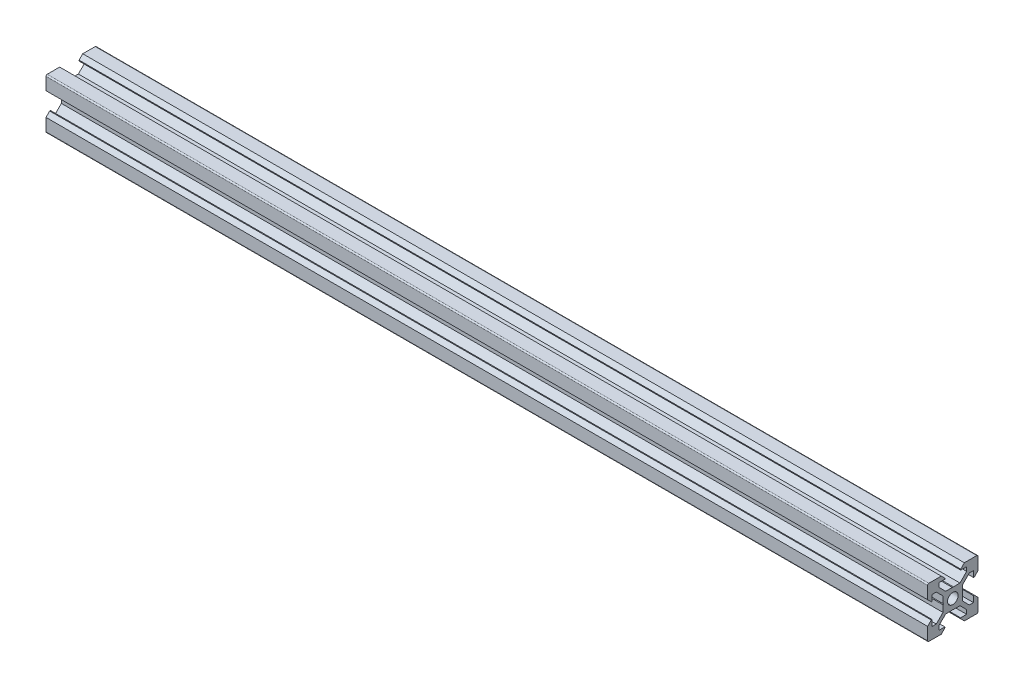
from build123d import *

# Parameters (mm, degrees)
PROFILE_SKETCH_R      = 2.1
PROFILE_EXTRUDE_DEPTH = 350


with BuildPart() as part:
    # Profile Sketch → Profile Extrude (new body)
    with BuildSketch(Plane(origin=(0, 0, 0), x_dir=(0, 0, -1), z_dir=(1, 0, 0))):
        with BuildLine():
            ThreePointArc((0, 9.5), (-0.146446609, 9.853553391), (-0.5, 10))
            Line((-0.5, 10), (-5.42, 10))
            Line((-5.42, 10), (-6.875, 8.545))
            Line((-6.875, 8.545), (-6.875, 8.2))
            Line((-6.875, 8.2), (-4.5, 8.2))
            Line((-4.5, 8.2), (-4.5, 6.56))
            Line((-4.5, 6.56), (-7.16, 3.9))
            Line((-7.16, 3.9), (-9.79, 3.9))
            Line((-9.79, 3.9), (-10, 3.69))
            Line((-10, 3.69), (-10.21, 3.9))
            Line((-10.21, 3.9), (-12.84, 3.9))
            Line((-12.84, 3.9), (-15.5, 6.56))
            Line((-15.5, 6.56), (-15.5, 8.2))
            Line((-15.5, 8.2), (-13.125, 8.2))
            Line((-13.125, 8.2), (-13.125, 8.545))
            Line((-13.125, 8.545), (-14.58, 10))
            Line((-14.58, 10), (-19.5, 10))
            ThreePointArc((-19.5, 10), (-19.853553391, 9.853553391), (-20, 9.5))
            Line((-20, 9.5), (-20, 4.58))
            Line((-20, 4.58), (-18.545, 3.125))
            Line((-18.545, 3.125), (-18.2, 3.125))
            Line((-18.2, 3.125), (-18.2, 5.5))
            Line((-18.2, 5.5), (-16.56, 5.5))
            Line((-16.56, 5.5), (-13.9, 2.838679656))
            Line((-13.9, 2.838679656), (-13.9, 0.21))
            Line((-13.9, 0.21), (-13.69, 0))
            Line((-13.69, 0), (-13.9, -0.21))
            Line((-13.9, -0.21), (-13.9, -2.838679656))
            Line((-13.9, -2.838679656), (-16.56, -5.5))
            Line((-16.56, -5.5), (-18.2, -5.5))
            Line((-18.2, -5.5), (-18.2, -3.125))
            Line((-18.2, -3.125), (-18.545, -3.125))
            Line((-18.545, -3.125), (-20, -4.58))
            Line((-20, -4.58), (-20, -9.5))
            ThreePointArc((-20, -9.5), (-19.853553391, -9.853553391), (-19.5, -10))
            Line((-19.5, -10), (-14.58, -10))
            Line((-14.58, -10), (-13.125, -8.545))
            Line((-13.125, -8.545), (-13.125, -8.2))
            Line((-13.125, -8.2), (-15.5, -8.2))
            Line((-15.5, -8.2), (-15.5, -6.56))
            Line((-15.5, -6.56), (-12.84, -3.9))
            Line((-12.84, -3.9), (-10.21, -3.9))
            Line((-10.21, -3.9), (-10, -3.69))
            Line((-10, -3.69), (-9.79, -3.9))
            Line((-9.79, -3.9), (-7.16, -3.9))
            Line((-7.16, -3.9), (-4.5, -6.56))
            Line((-4.5, -6.56), (-4.5, -8.2))
            Line((-4.5, -8.2), (-6.875, -8.2))
            Line((-6.875, -8.2), (-6.875, -8.545))
            Line((-6.875, -8.545), (-5.42, -10))
            Line((-5.42, -10), (-0.5, -10))
            ThreePointArc((-0.5, -10), (-0.146446609, -9.853553391), (0, -9.5))
            Line((0, -9.5), (0, -4.58))
            Line((0, -4.58), (-1.455, -3.125))
            Line((-1.455, -3.125), (-1.8, -3.125))
            Line((-1.8, -3.125), (-1.8, -5.5))
            Line((-1.8, -5.5), (-3.44, -5.5))
            Line((-3.44, -5.5), (-6.1, -2.838679656))
            Line((-6.1, -2.838679656), (-6.1, -0.21))
            Line((-6.1, -0.21), (-6.1, 2.838679656))
            Line((-6.1, 2.838679656), (-3.438679656, 5.5))
            Line((-3.438679656, 5.5), (-1.8, 5.5))
            Line((-1.8, 5.5), (-1.8, 3.125))
            Line((-1.8, 3.125), (-1.455, 3.125))
            Line((-1.455, 3.125), (0, 4.58))
            Line((0, 4.58), (0, 9.5))
        make_face()
        with Locations((-10, 0)):
            Circle(PROFILE_SKETCH_R, mode=Mode.SUBTRACT)
    extrude(amount=PROFILE_EXTRUDE_DEPTH)


solid = part.part
